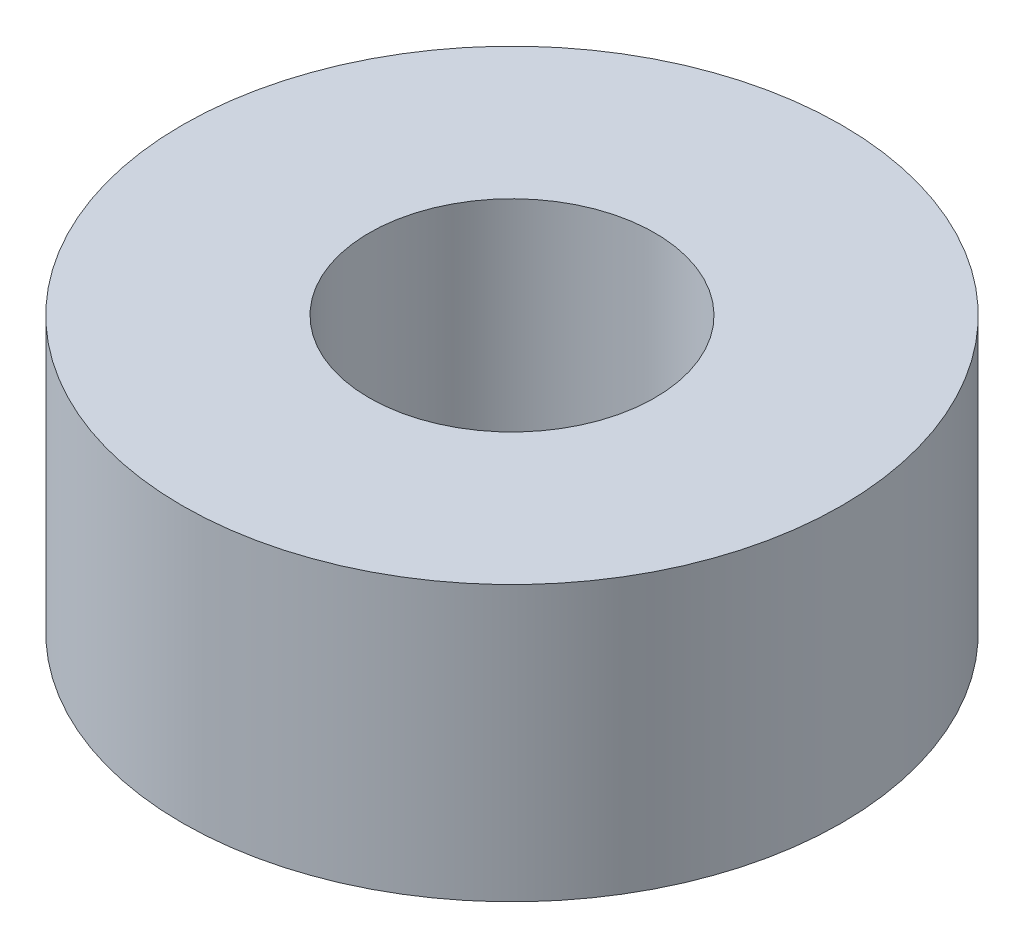
from build123d import *

# Parameters (mm, degrees)
SKETCH1_R           = 6
SKETCH1_R_2         = 2.6
BOSS_EXTRUDE1_DEPTH = 5


with BuildPart() as part:
    # Sketch1 → Boss-Extrude1 (new body)
    with BuildSketch(Plane(origin=(0, 0, 0), x_dir=(1, 0, 0), z_dir=(0, 1, 0))):
        Circle(SKETCH1_R)
        Circle(SKETCH1_R_2, mode=Mode.SUBTRACT)
    extrude(amount=BOSS_EXTRUDE1_DEPTH)


solid = part.part
